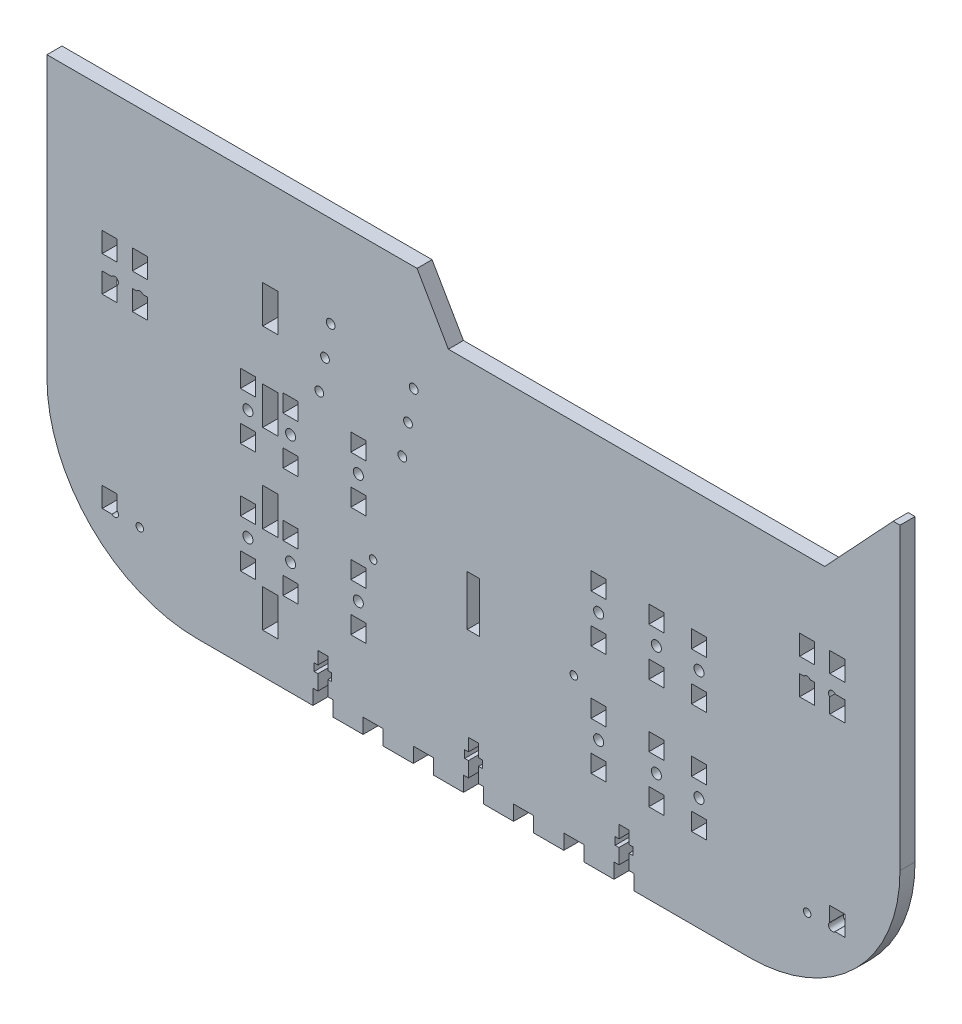
from build123d import *

# Parameters (mm, degrees)
ESQUISSE1_W              = 340
ESQUISSE1_H              = 260
BOSS_EXTRU_1_DEPTH       = 6
ESQUISSE10_W             = 6
ESQUISSE10_H             = 7
ESQUISSE10_R             = 2
ESQUISSE10_W_2           = 5
ESQUISSE10_H_2           = 20
ENL_V_MAT_EXTRU_5_DEPTH  = 6
ESQUISSE13_R             = 1.5
ENL_V_MAT_EXTRU_6_DEPTH  = 6
CONG_1_R                 = 60
ESQUISSE14_W             = 180
ESQUISSE14_H             = 10
ENL_V_MAT_EXTRU_7_DEPTH  = 10
ESQUISSE15_W             = 120
ESQUISSE15_H             = 2
ENL_V_MAT_EXTRU_8_DEPTH  = 10
CONG_2_R                 = 10
CONG_3_R                 = 8
ESQUISSE16_R             = 1.75
ENL_V_MAT_EXTRU_9_DEPTH  = 6
ENL_V_MAT_EXTRU_10_DEPTH = 10
ESQUISSE18_W             = 8
ESQUISSE18_H             = 6
ENL_V_MAT_EXTRU_11_DEPTH = 10
ENL_V_MAT_EXTRU_13_DEPTH = 6
ENL_V_MAT_EXTRU_14_DEPTH = 10
ESQUISSE21_W             = 6
ESQUISSE21_H             = 8
ENL_V_MAT_EXTRU_15_DEPTH = 10
ESQUISSE22_W             = 6
ESQUISSE22_H             = 15
ENL_V_MAT_EXTRU_16_DEPTH = 6
ENL_V_MAT_EXTRU_17_DEPTH = 385.406099845


with BuildPart() as part:
    # Esquisse1 → Boss.-Extru.1 (new body)
    with BuildSketch(Plane.XY):
        with Locations((-170, 130)):
            Rectangle(ESQUISSE1_W, ESQUISSE1_H)
    extrude(amount=-BOSS_EXTRU_1_DEPTH)

    # Esquisse10 → Enlèv. mat.-Extru.5 (cut)
    with BuildSketch(Plane(origin=(0, 0, -6), x_dir=(-1, 0, 0), z_dir=(0, 0, -1))):
        with Locations((80.1, 54.5)):
            Rectangle(ESQUISSE10_W, ESQUISSE10_H)
        with Locations((80.1, 79.5)):
            Rectangle(ESQUISSE10_W, ESQUISSE10_H)
        with Locations((80.1, 98.5)):
            Rectangle(ESQUISSE10_W, ESQUISSE10_H)
        with Locations((120.1, 98.5)):
            Rectangle(ESQUISSE10_W, ESQUISSE10_H)
        with Locations((120.1, 35.5)):
            Rectangle(ESQUISSE10_W, ESQUISSE10_H)
        with Locations((215.9, 79.5)):
            Rectangle(ESQUISSE10_W, ESQUISSE10_H)
        with Locations((215.9, 98.5)):
            Rectangle(ESQUISSE10_W, ESQUISSE10_H)
        with Locations((215.9, 35.5)):
            Rectangle(ESQUISSE10_W, ESQUISSE10_H)
        with Locations((242.9, 35.5)):
            Rectangle(ESQUISSE10_W, ESQUISSE10_H)
        with Locations((259.9, 35.5)):
            Rectangle(ESQUISSE10_W, ESQUISSE10_H)
        with Locations((259.9, 54.5)):
            Rectangle(ESQUISSE10_W, ESQUISSE10_H)
        with Locations((259.9, 79.5)):
            Rectangle(ESQUISSE10_W, ESQUISSE10_H)
        with Locations((259.9, 98.5)):
            Rectangle(ESQUISSE10_W, ESQUISSE10_H)
        with Locations((80.1, 35.5)):
            Rectangle(ESQUISSE10_W, ESQUISSE10_H)
        with Locations((97.1, 98.5)):
            Rectangle(ESQUISSE10_W, ESQUISSE10_H)
        with Locations((97.1, 79.5)):
            Rectangle(ESQUISSE10_W, ESQUISSE10_H)
        with Locations((120.1, 79.5)):
            Rectangle(ESQUISSE10_W, ESQUISSE10_H)
        with Locations((120.1, 54.5)):
            Rectangle(ESQUISSE10_W, ESQUISSE10_H)
        with Locations((97.1, 54.5)):
            Rectangle(ESQUISSE10_W, ESQUISSE10_H)
        with Locations((97.1, 35.5)):
            Rectangle(ESQUISSE10_W, ESQUISSE10_H)
        with Locations(Location((120.1, 45, 0), (0, 0, 180))):
            Circle(ESQUISSE10_R)
        with Locations(Location((97.1, 45, 0), (0, 0, 180))):
            Circle(ESQUISSE10_R)
        with Locations(Location((80.1, 45, 0), (0, 0, 180))):
            Circle(ESQUISSE10_R)
        with Locations(Location((80.1, 89, 0), (0, 0, 180))):
            Circle(ESQUISSE10_R)
        with Locations(Location((97.1, 89, 0), (0, 0, 180))):
            Circle(ESQUISSE10_R)
        with Locations(Location((120.1, 89, 0), (0, 0, 180))):
            Circle(ESQUISSE10_R)
        with Locations((170, 67)):
            Rectangle(ESQUISSE10_W_2, ESQUISSE10_H_2)
        with Locations((242.9, 98.5)):
            Rectangle(ESQUISSE10_W, ESQUISSE10_H)
        with Locations((215.9, 89)):
            Circle(ESQUISSE10_R)
        with Locations((242.9, 89)):
            Circle(ESQUISSE10_R)
        with Locations((242.9, 79.5)):
            Rectangle(ESQUISSE10_W, ESQUISSE10_H)
        with Locations((242.9, 54.5)):
            Rectangle(ESQUISSE10_W, ESQUISSE10_H)
        with Locations((215.9, 54.5)):
            Rectangle(ESQUISSE10_W, ESQUISSE10_H)
        with Locations((259.9, 89)):
            Circle(ESQUISSE10_R)
        with Locations((259.9, 45)):
            Circle(ESQUISSE10_R)
        with Locations((242.9, 45)):
            Circle(ESQUISSE10_R)
        with Locations((215.9, 45)):
            Circle(ESQUISSE10_R)
    extrude(amount=-ENL_V_MAT_EXTRU_5_DEPTH, mode=Mode.SUBTRACT)

    # Esquisse13 → Enlèv. mat.-Extru.6 (cut)
    with BuildSketch(Plane(origin=(0, 0, -6), x_dir=(-1, 0, 0), z_dir=(0, 0, -1))):
        with Locations((27, 27)):
            Circle(ESQUISSE13_R)
        with Locations((130, 62.4)):
            Circle(ESQUISSE13_R)
        with Locations(Location((210, 62.4, 0), (0, 0, 180))):
            Circle(ESQUISSE13_R)
        with Locations((37, 27)):
            Circle(ESQUISSE13_R)
        with Locations(Location((37, 107.148940914, 0), (0, 0, 180))):
            Circle(ESQUISSE13_R)
        with Locations(Location((27, 107.148940914, 0), (0, 0, 180))):
            Circle(ESQUISSE13_R)
        with Locations(Location((303, 27, 0), (0, 0, 180))):
            Circle(ESQUISSE13_R)
        with Locations(Location((313, 27, 0), (0, 0, 180))):
            Circle(ESQUISSE13_R)
        with Locations((313, 107.148940914)):
            Circle(ESQUISSE13_R)
        with Locations((303, 107.148940914)):
            Circle(ESQUISSE13_R)
    extrude(amount=-ENL_V_MAT_EXTRU_6_DEPTH, mode=Mode.SUBTRACT)

    # Congé1
    cong_1_edges = [part.edges().sort_by_distance(p)[0] for p in [
        (0, 0, -3),
        (-340, 0, -3),
    ]]
    fillet(cong_1_edges, radius=CONG_1_R)

    # Esquisse14 → Enlèv. mat.-Extru.7 (cut)
    with BuildSketch(Plane(origin=(0, 0, -6), x_dir=(-1, 0, 0), z_dir=(0, 0, -1))):
        with Locations((235, 255)):
            Rectangle(ESQUISSE14_W, ESQUISSE14_H)
    extrude(amount=-ENL_V_MAT_EXTRU_7_DEPTH, mode=Mode.SUBTRACT)

    # Esquisse15 → Enlèv. mat.-Extru.8 (cut)
    with BuildSketch(Plane.XY):
        with Locations((-250, 249)):
            Rectangle(ESQUISSE15_W, ESQUISSE15_H)
    extrude(amount=-ENL_V_MAT_EXTRU_8_DEPTH, mode=Mode.SUBTRACT)

    # Congé2
    # the kernel refuses this fillet: 10 mm, written as the material it takes off along each edge
    with BuildSketch(Plane(origin=(-190, 250, 15), x_dir=(1, 0, 0), z_dir=(0, 0, -1))) as cong_2_piece_1:
        with BuildLine():
            CenterArc((6, 10), CONG_2_R, 233.130102354, 36.869897646)
            Line((0, 2), (-0.12, 1.84))
            ThreePointArc((-0.12, 1.84), (-0.2, 1), (-0.2, 0))
            Line((-0.2, 0), (0, -0.2))
            Line((0, -0.2), (6, -0.2))
            Line((6, -0.2), (6, 0))
        make_face()
    extrude(amount=36, mode=Mode.SUBTRACT)
    with BuildSketch(Plane(origin=(-310, 250, 15), x_dir=(0, -1, 0), z_dir=(0, 0, -1))) as cong_2_piece_2:
        with BuildLine():
            CenterArc((10, 6), CONG_2_R, 180, 36.869897646)
            Line((0, 6), (-0.2, 6))
            Line((-0.2, 6), (-0.2, 0))
            Line((-0.2, 0), (0, -0.2))
            ThreePointArc((0, -0.2), (1, -0.2), (1.84, -0.12))
            Line((1.84, -0.12), (2, 0))
        make_face()
    extrude(amount=36, mode=Mode.SUBTRACT)

    # Congé3
    cong_3_edges = [part.edges().sort_by_distance(p)[0] for p in [
        (-325, 260, -3),
        (-145, 260, -3),
    ]]
    fillet(cong_3_edges, radius=CONG_3_R)

    # Esquisse16 → Enlèv. mat.-Extru.9 (cut)
    with BuildSketch(Plane.XY):
        with Locations((-231.45, 109.66)):
            Circle(ESQUISSE16_R)
        with Locations((-226.93, 135.27)):
            Circle(ESQUISSE16_R)
        with Locations((-229.19, 122.465)):
            Circle(ESQUISSE16_R)
        with Locations((-198.36, 103.83)):
            Circle(ESQUISSE16_R)
        with Locations((-193.84, 129.44)):
            Circle(ESQUISSE16_R)
        with Locations((-196.1, 116.635)):
            Circle(ESQUISSE16_R)
    extrude(amount=-ENL_V_MAT_EXTRU_9_DEPTH, mode=Mode.SUBTRACT)

    # Esquisse17 → Enlèv. mat.-Extru.10 (cut)
    with BuildSketch(Plane.XY):
        Polygon((-29.216285169, 245.39755551), (-23.478456633, 247.151785738), (-25.817430271, 254.802223786), (-31.555258806, 253.047993558), align=None)
        Polygon((-23.368851074, 226.271460391), (-17.631022538, 228.025690619), (-19.969996176, 235.676128667), (-25.707824712, 233.921898438), align=None)
        Polygon((-17.52141698, 207.145365271), (-11.783588444, 208.8995955), (-14.122562082, 216.550033547), (-19.860390617, 214.795803319), align=None)
        Polygon((-180, 150), (-30, 150), (-2.720065597, 179.254148065), (-9.568281369, 188.663047712), (-5.936154349, 189.77350038), (-8.275127987, 197.423938428), (-14.012956523, 195.6697082), (-13.538488979, 194.117794792), (-102.15398245, 315.868381088), (-205, 193.301270189), align=None)
    extrude(amount=-ENL_V_MAT_EXTRU_10_DEPTH, mode=Mode.SUBTRACT)

    # Esquisse18 → Enlèv. mat.-Extru.11 (cut)
    with BuildSketch(Plane.XY):
        with Locations((-110, 3)):
            Rectangle(ESQUISSE18_W, ESQUISSE18_H)
        with Locations((-130, 3)):
            Rectangle(ESQUISSE18_W, ESQUISSE18_H)
        with Locations((-150, 3)):
            Rectangle(ESQUISSE18_W, ESQUISSE18_H)
        with Locations((-170, 3)):
            Rectangle(ESQUISSE18_W, ESQUISSE18_H)
        with Locations((-190, 3)):
            Rectangle(ESQUISSE18_W, ESQUISSE18_H)
        with Locations((-210, 3)):
            Rectangle(ESQUISSE18_W, ESQUISSE18_H)
        with Locations((-230, 3)):
            Rectangle(ESQUISSE18_W, ESQUISSE18_H)
    extrude(amount=-ENL_V_MAT_EXTRU_11_DEPTH, mode=Mode.SUBTRACT)

    # Esquisse19 → Enlèv. mat.-Extru.13 (cut)
    with BuildSketch(Plane.XY):
        Polygon((-27.406549935, 260), (-61.490489073, 260), (-13.538488979, 194.117794792), (-14.012956523, 195.6697082), (-8.275127987, 197.423938428), (-5.936154349, 189.77350038), (-9.568281369, 188.663047712), (-2.720065597, 179.254148065), (0, 179.254148065), (0, 193.164126288), (0, 260), align=None)
        Polygon((-19.860390617, 214.795803319), (-14.122562082, 216.550033547), (-11.783588444, 208.8995955), (-17.52141698, 207.145365271), align=None, mode=Mode.SUBTRACT)
        Polygon((-25.707824712, 233.921898438), (-19.969996176, 235.676128667), (-17.631022538, 228.025690619), (-23.368851074, 226.271460391), align=None, mode=Mode.SUBTRACT)
        Polygon((-23.478456633, 247.151785738), (-29.216285169, 245.39755551), (-31.555258806, 253.047993558), (-25.817430271, 254.802223786), align=None, mode=Mode.SUBTRACT)
    extrude(amount=-ENL_V_MAT_EXTRU_13_DEPTH, mode=Mode.SUBTRACT)

    # Esquisse20 → Enlèv. mat.-Extru.14 (cut)
    with BuildSketch(Plane.XY):
        Polygon((-192.5, 171.650635095), (-340, 171.650635095), (-340, 260), (-157.424116728, 260.642727797), (-157.424116728, 250), align=None)
    extrude(amount=-ENL_V_MAT_EXTRU_14_DEPTH, mode=Mode.SUBTRACT)

    # Esquisse21 → Enlèv. mat.-Extru.15 (cut)
    with BuildSketch(Plane.XY):
        with Locations((-303, 118)):
            Rectangle(ESQUISSE21_W, ESQUISSE21_H)
        with Locations((-315, 118)):
            Rectangle(ESQUISSE21_W, ESQUISSE21_H)
        with Locations((-315, 104)):
            Rectangle(ESQUISSE21_W, ESQUISSE21_H)
        with Locations((-303, 104)):
            Rectangle(ESQUISSE21_W, ESQUISSE21_H)
        with Locations((-315, 30)):
            Rectangle(ESQUISSE21_W, ESQUISSE21_H)
        with Locations((-25, 30)):
            Rectangle(ESQUISSE21_W, ESQUISSE21_H)
        with Locations((-37, 104)):
            Rectangle(ESQUISSE21_W, ESQUISSE21_H)
        with Locations((-37, 118)):
            Rectangle(ESQUISSE21_W, ESQUISSE21_H)
        with Locations((-25, 104)):
            Rectangle(ESQUISSE21_W, ESQUISSE21_H)
        with Locations((-25, 118)):
            Rectangle(ESQUISSE21_W, ESQUISSE21_H)
    extrude(amount=-ENL_V_MAT_EXTRU_15_DEPTH, mode=Mode.SUBTRACT)

    # Esquisse22 → Enlèv. mat.-Extru.16 (cut)
    with BuildSketch(Plane(origin=(0, 0, -6), x_dir=(-1, 0, 0), z_dir=(0, 0, -1))):
        with Locations((251, 128.5)):
            Rectangle(ESQUISSE22_W, ESQUISSE22_H)
        with Locations((251, 93.5)):
            Rectangle(ESQUISSE22_W, ESQUISSE22_H)
        with Locations((251, 58.5)):
            Rectangle(ESQUISSE22_W, ESQUISSE22_H)
        with Locations((251, 23.5)):
            Rectangle(ESQUISSE22_W, ESQUISSE22_H)
    extrude(amount=-ENL_V_MAT_EXTRU_16_DEPTH, mode=Mode.SUBTRACT)

    # Esquisse23 → Enlèv. mat.-Extru.17 (cut, through all)
    with BuildSketch(Plane(origin=(0, 0, -6), x_dir=(-1, 0, 0), z_dir=(0, 0, -1))):
        Polygon((108, 6), (112, 6), (112, 12), (113.5, 12), (113.5, 15), (112, 15), (112, 20), (108, 20), (108, 15), (106.5, 15), (106.5, 12), (108, 12), align=None)
        Polygon((168, 6), (172, 6), (172, 12), (173.5, 12), (173.5, 15), (172, 15), (172, 20), (168, 20), (168, 15), (166.5, 15), (166.5, 12), (168, 12), align=None)
        Polygon((228, 6), (232, 6), (232, 12), (233.5, 12), (233.5, 15), (232, 15), (232, 20), (228, 20), (228, 15), (226.5, 15), (226.5, 12), (228, 12), align=None)
    extrude(amount=-ENL_V_MAT_EXTRU_17_DEPTH, mode=Mode.SUBTRACT)


solid = part.part
